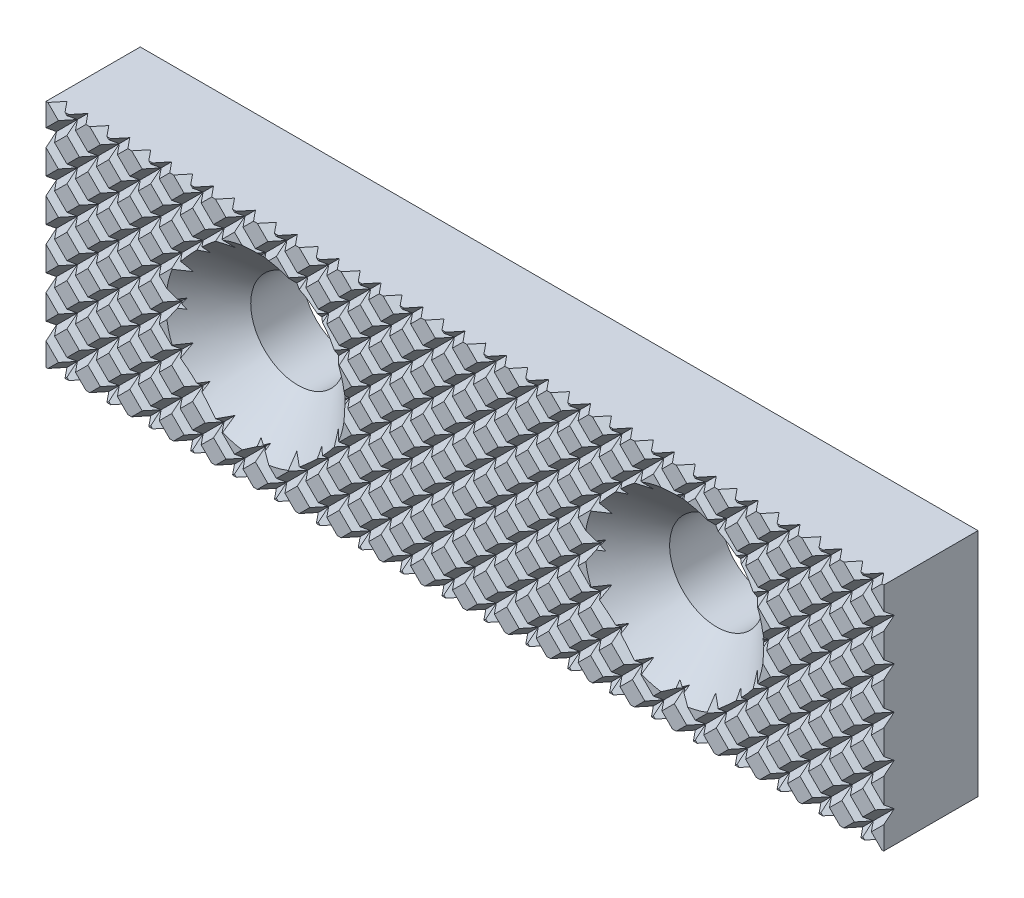
from build123d import *

# Parameters (mm, degrees)
SKETCH_1_W             = 80
SKETCH_1_H             = 22
EXTRUDE_3_DEPTH        = 9
SKETCH_6_R             = 4.5
CUT_EXTRUDE_2_DEPTH    = 43.449970554
CHAMFER_1_SIZE         = 4.05
CHAMFER_2_SIZE         = 4.05
CUT_EXTRUDE_3_DEPTH    = 69.132224388
PATTERN_LINEAR_4_COUNT = 13
PATTERN_LINEAR_4_PITCH = 4
PATTERN_LINEAR_5_COUNT = 15
PATTERN_LINEAR_5_PITCH = 4
MIRROR_1_COPY_1_DEPTH  = 69.132224388
MIRROR_1_COPY_2_DEPTH  = 69.132224388
MIRROR_1_COPY_3_DEPTH  = 69.132224388
MIRROR_1_COPY_4_DEPTH  = 69.132224388
MIRROR_1_COPY_5_DEPTH  = 69.132224388
MIRROR_1_COPY_6_DEPTH  = 69.132224388
MIRROR_1_COPY_7_DEPTH  = 69.132224388
MIRROR_1_COPY_8_DEPTH  = 69.132224388
MIRROR_1_COPY_9_DEPTH  = 69.132224388
MIRROR_1_COPY_10_DEPTH = 69.132224388
MIRROR_1_COPY_11_DEPTH = 69.132224388
MIRROR_1_COPY_12_DEPTH = 69.132224388
MIRROR_1_COPY_13_DEPTH = 69.132224388
MIRROR_1_COPY_14_DEPTH = 69.132224388
MIRROR_1_COPY_15_DEPTH = 69.132224388
MIRROR_1_COPY_16_DEPTH = 69.132224388
MIRROR_1_COPY_17_DEPTH = 69.132224388
MIRROR_1_COPY_18_DEPTH = 69.132224388
MIRROR_1_COPY_19_DEPTH = 69.132224388
MIRROR_1_COPY_20_DEPTH = 69.132224388
MIRROR_1_COPY_21_DEPTH = 69.132224388
MIRROR_1_COPY_22_DEPTH = 69.132224388
MIRROR_1_COPY_23_DEPTH = 69.132224388
MIRROR_1_COPY_24_DEPTH = 69.132224388
MIRROR_1_COPY_25_DEPTH = 69.132224388
MIRROR_1_COPY_26_DEPTH = 69.132224388
MIRROR_1_COPY_27_DEPTH = 69.132224388
MIRROR_1_COPY_28_DEPTH = 69.132224388


with BuildPart() as part:
    # 草图1 → 凸台-拉伸3 (new body)
    with BuildSketch(Plane.XY):
        Rectangle(SKETCH_1_W, SKETCH_1_H)
    extrude(amount=EXTRUDE_3_DEPTH)

    # 草图6 → 切除-拉伸2 (cut, through all)
    with BuildSketch(Plane.XY.offset(9)):
        with Locations((-20, 0)):
            Circle(SKETCH_6_R)
        with Locations((20, 0)):
            Circle(SKETCH_6_R)
    extrude(amount=-CUT_EXTRUDE_2_DEPTH, mode=Mode.SUBTRACT)

    # 倒角1
    chamfer_1_edges = [part.edges().sort_by_distance(p)[0] for p in [
        (-24.5, 0, 9),
    ]]
    chamfer(chamfer_1_edges, length=CHAMFER_1_SIZE)

    # 倒角2
    chamfer_2_edges = [part.edges().sort_by_distance(p)[0] for p in [
        (15.5, 0, 9),
    ]]
    chamfer(chamfer_2_edges, length=CHAMFER_2_SIZE)

    # 草图7 → 切除-拉伸3 (cut, through all)
    with BuildSketch(Plane(origin=(-20, -20, 0), x_dir=(0.7071067811865462, -0.7071067811865488, 0), z_dir=(-0.7071067811865488, -0.7071067811865462, 0))):
        Polygon((0, 8), (-0.577350269, 9), (0.577350269, 9), align=None)
    cut_extrude_3 = extrude(amount=-CUT_EXTRUDE_3_DEPTH, mode=Mode.SUBTRACT)

    # 阵列(线性)4: 切除-拉伸3 ×13
    with Locations(*[(-i * PATTERN_LINEAR_4_PITCH, 0, 0) for i in range(1, PATTERN_LINEAR_4_COUNT)]):
        add(cut_extrude_3, mode=Mode.SUBTRACT)

    # 阵列(线性)5: 切除-拉伸3 ×15
    with Locations(*[(i * PATTERN_LINEAR_5_PITCH, 0, 0) for i in range(1, PATTERN_LINEAR_5_COUNT)]):
        add(cut_extrude_3, mode=Mode.SUBTRACT)

    # 镜向1 copy 1 sketch → 镜向1 copy 1 (cut, through all)
    with BuildSketch(Plane(origin=(24, -20, 0), x_dir=(-0.7071067811865462, -0.7071067811865488, 0), z_dir=(0.7071067811865488, -0.7071067811865462, 0))):
        Polygon((0, -8), (-0.577350269, -9), (0.577350269, -9), align=None)
    extrude(amount=-MIRROR_1_COPY_1_DEPTH, mode=Mode.SUBTRACT)

    # 镜向1 copy 2 sketch → 镜向1 copy 2 (cut, through all)
    with BuildSketch(Plane(origin=(28, -20, 0), x_dir=(-0.7071067811865462, -0.7071067811865488, 0), z_dir=(0.7071067811865488, -0.7071067811865462, 0))):
        Polygon((0, -8), (-0.577350269, -9), (0.577350269, -9), align=None)
    extrude(amount=-MIRROR_1_COPY_2_DEPTH, mode=Mode.SUBTRACT)

    # 镜向1 copy 3 sketch → 镜向1 copy 3 (cut, through all)
    with BuildSketch(Plane(origin=(32, -20, 0), x_dir=(-0.7071067811865462, -0.7071067811865488, 0), z_dir=(0.7071067811865488, -0.7071067811865462, 0))):
        Polygon((0, -8), (-0.577350269, -9), (0.577350269, -9), align=None)
    extrude(amount=-MIRROR_1_COPY_3_DEPTH, mode=Mode.SUBTRACT)

    # 镜向1 copy 4 sketch → 镜向1 copy 4 (cut, through all)
    with BuildSketch(Plane(origin=(36, -20, 0), x_dir=(-0.7071067811865462, -0.7071067811865488, 0), z_dir=(0.7071067811865488, -0.7071067811865462, 0))):
        Polygon((0, -8), (-0.577350269, -9), (0.577350269, -9), align=None)
    extrude(amount=-MIRROR_1_COPY_4_DEPTH, mode=Mode.SUBTRACT)

    # 镜向1 copy 5 sketch → 镜向1 copy 5 (cut, through all)
    with BuildSketch(Plane(origin=(40, -20, 0), x_dir=(-0.7071067811865462, -0.7071067811865488, 0), z_dir=(0.7071067811865488, -0.7071067811865462, 0))):
        Polygon((0, -8), (-0.577350269, -9), (0.577350269, -9), align=None)
    extrude(amount=-MIRROR_1_COPY_5_DEPTH, mode=Mode.SUBTRACT)

    # 镜向1 copy 6 sketch → 镜向1 copy 6 (cut, through all)
    with BuildSketch(Plane(origin=(44, -20, 0), x_dir=(-0.7071067811865462, -0.7071067811865488, 0), z_dir=(0.7071067811865488, -0.7071067811865462, 0))):
        Polygon((0, -8), (-0.577350269, -9), (0.577350269, -9), align=None)
    extrude(amount=-MIRROR_1_COPY_6_DEPTH, mode=Mode.SUBTRACT)

    # 镜向1 copy 7 sketch → 镜向1 copy 7 (cut, through all)
    with BuildSketch(Plane(origin=(48, -20, 0), x_dir=(-0.7071067811865462, -0.7071067811865488, 0), z_dir=(0.7071067811865488, -0.7071067811865462, 0))):
        Polygon((0, -8), (-0.577350269, -9), (0.577350269, -9), align=None)
    extrude(amount=-MIRROR_1_COPY_7_DEPTH, mode=Mode.SUBTRACT)

    # 镜向1 copy 8 sketch → 镜向1 copy 8 (cut, through all)
    with BuildSketch(Plane(origin=(52, -20, 0), x_dir=(-0.7071067811865462, -0.7071067811865488, 0), z_dir=(0.7071067811865488, -0.7071067811865462, 0))):
        Polygon((0, -8), (-0.577350269, -9), (0.577350269, -9), align=None)
    extrude(amount=-MIRROR_1_COPY_8_DEPTH, mode=Mode.SUBTRACT)

    # 镜向1 copy 9 sketch → 镜向1 copy 9 (cut, through all)
    with BuildSketch(Plane(origin=(56, -20, 0), x_dir=(-0.7071067811865462, -0.7071067811865488, 0), z_dir=(0.7071067811865488, -0.7071067811865462, 0))):
        Polygon((0, -8), (-0.577350269, -9), (0.577350269, -9), align=None)
    extrude(amount=-MIRROR_1_COPY_9_DEPTH, mode=Mode.SUBTRACT)

    # 镜向1 copy 10 sketch → 镜向1 copy 10 (cut, through all)
    with BuildSketch(Plane(origin=(60, -20, 0), x_dir=(-0.7071067811865462, -0.7071067811865488, 0), z_dir=(0.7071067811865488, -0.7071067811865462, 0))):
        Polygon((0, -8), (-0.577350269, -9), (0.577350269, -9), align=None)
    extrude(amount=-MIRROR_1_COPY_10_DEPTH, mode=Mode.SUBTRACT)

    # 镜向1 copy 11 sketch → 镜向1 copy 11 (cut, through all)
    with BuildSketch(Plane(origin=(64, -20, 0), x_dir=(-0.7071067811865462, -0.7071067811865488, 0), z_dir=(0.7071067811865488, -0.7071067811865462, 0))):
        Polygon((0, -8), (-0.577350269, -9), (0.577350269, -9), align=None)
    extrude(amount=-MIRROR_1_COPY_11_DEPTH, mode=Mode.SUBTRACT)

    # 镜向1 copy 12 sketch → 镜向1 copy 12 (cut, through all)
    with BuildSketch(Plane(origin=(68, -20, 0), x_dir=(-0.7071067811865462, -0.7071067811865488, 0), z_dir=(0.7071067811865488, -0.7071067811865462, 0))):
        Polygon((0, -8), (-0.577350269, -9), (0.577350269, -9), align=None)
    extrude(amount=-MIRROR_1_COPY_12_DEPTH, mode=Mode.SUBTRACT)

    # 镜向1 copy 13 sketch → 镜向1 copy 13 (cut, through all)
    with BuildSketch(Plane(origin=(20, -20, 0), x_dir=(-0.7071067811865462, -0.7071067811865488, 0), z_dir=(0.7071067811865488, -0.7071067811865462, 0))):
        Polygon((0, -8), (-0.577350269, -9), (0.577350269, -9), align=None)
    extrude(amount=-MIRROR_1_COPY_13_DEPTH, mode=Mode.SUBTRACT)

    # 镜向1 copy 14 sketch → 镜向1 copy 14 (cut, through all)
    with BuildSketch(Plane(origin=(16, -20, 0), x_dir=(-0.7071067811865462, -0.7071067811865488, 0), z_dir=(0.7071067811865488, -0.7071067811865462, 0))):
        Polygon((0, -8), (-0.577350269, -9), (0.577350269, -9), align=None)
    extrude(amount=-MIRROR_1_COPY_14_DEPTH, mode=Mode.SUBTRACT)

    # 镜向1 copy 15 sketch → 镜向1 copy 15 (cut, through all)
    with BuildSketch(Plane(origin=(12, -20, 0), x_dir=(-0.7071067811865462, -0.7071067811865488, 0), z_dir=(0.7071067811865488, -0.7071067811865462, 0))):
        Polygon((0, -8), (-0.577350269, -9), (0.577350269, -9), align=None)
    extrude(amount=-MIRROR_1_COPY_15_DEPTH, mode=Mode.SUBTRACT)

    # 镜向1 copy 16 sketch → 镜向1 copy 16 (cut, through all)
    with BuildSketch(Plane(origin=(8, -20, 0), x_dir=(-0.7071067811865462, -0.7071067811865488, 0), z_dir=(0.7071067811865488, -0.7071067811865462, 0))):
        Polygon((0, -8), (-0.577350269, -9), (0.577350269, -9), align=None)
    extrude(amount=-MIRROR_1_COPY_16_DEPTH, mode=Mode.SUBTRACT)

    # 镜向1 copy 17 sketch → 镜向1 copy 17 (cut, through all)
    with BuildSketch(Plane(origin=(4, -20, 0), x_dir=(-0.7071067811865462, -0.7071067811865488, 0), z_dir=(0.7071067811865488, -0.7071067811865462, 0))):
        Polygon((0, -8), (-0.577350269, -9), (0.577350269, -9), align=None)
    extrude(amount=-MIRROR_1_COPY_17_DEPTH, mode=Mode.SUBTRACT)

    # 镜向1 copy 18 sketch → 镜向1 copy 18 (cut, through all)
    with BuildSketch(Plane(origin=(0, -20, 0), x_dir=(-0.7071067811865462, -0.7071067811865488, 0), z_dir=(0.7071067811865488, -0.7071067811865462, 0))):
        Polygon((0, -8), (-0.577350269, -9), (0.577350269, -9), align=None)
    extrude(amount=-MIRROR_1_COPY_18_DEPTH, mode=Mode.SUBTRACT)

    # 镜向1 copy 19 sketch → 镜向1 copy 19 (cut, through all)
    with BuildSketch(Plane(origin=(-4, -20, 0), x_dir=(-0.7071067811865462, -0.7071067811865488, 0), z_dir=(0.7071067811865488, -0.7071067811865462, 0))):
        Polygon((0, -8), (-0.577350269, -9), (0.577350269, -9), align=None)
    extrude(amount=-MIRROR_1_COPY_19_DEPTH, mode=Mode.SUBTRACT)

    # 镜向1 copy 20 sketch → 镜向1 copy 20 (cut, through all)
    with BuildSketch(Plane(origin=(-8, -20, 0), x_dir=(-0.7071067811865462, -0.7071067811865488, 0), z_dir=(0.7071067811865488, -0.7071067811865462, 0))):
        Polygon((0, -8), (-0.577350269, -9), (0.577350269, -9), align=None)
    extrude(amount=-MIRROR_1_COPY_20_DEPTH, mode=Mode.SUBTRACT)

    # 镜向1 copy 21 sketch → 镜向1 copy 21 (cut, through all)
    with BuildSketch(Plane(origin=(-12, -20, 0), x_dir=(-0.7071067811865462, -0.7071067811865488, 0), z_dir=(0.7071067811865488, -0.7071067811865462, 0))):
        Polygon((0, -8), (-0.577350269, -9), (0.577350269, -9), align=None)
    extrude(amount=-MIRROR_1_COPY_21_DEPTH, mode=Mode.SUBTRACT)

    # 镜向1 copy 22 sketch → 镜向1 copy 22 (cut, through all)
    with BuildSketch(Plane(origin=(-16, -20, 0), x_dir=(-0.7071067811865462, -0.7071067811865488, 0), z_dir=(0.7071067811865488, -0.7071067811865462, 0))):
        Polygon((0, -8), (-0.577350269, -9), (0.577350269, -9), align=None)
    extrude(amount=-MIRROR_1_COPY_22_DEPTH, mode=Mode.SUBTRACT)

    # 镜向1 copy 23 sketch → 镜向1 copy 23 (cut, through all)
    with BuildSketch(Plane(origin=(-20, -20, 0), x_dir=(-0.7071067811865462, -0.7071067811865488, 0), z_dir=(0.7071067811865488, -0.7071067811865462, 0))):
        Polygon((0, -8), (-0.577350269, -9), (0.577350269, -9), align=None)
    extrude(amount=-MIRROR_1_COPY_23_DEPTH, mode=Mode.SUBTRACT)

    # 镜向1 copy 24 sketch → 镜向1 copy 24 (cut, through all)
    with BuildSketch(Plane(origin=(-24, -20, 0), x_dir=(-0.7071067811865462, -0.7071067811865488, 0), z_dir=(0.7071067811865488, -0.7071067811865462, 0))):
        Polygon((0, -8), (-0.577350269, -9), (0.577350269, -9), align=None)
    extrude(amount=-MIRROR_1_COPY_24_DEPTH, mode=Mode.SUBTRACT)

    # 镜向1 copy 25 sketch → 镜向1 copy 25 (cut, through all)
    with BuildSketch(Plane(origin=(-28, -20, 0), x_dir=(-0.7071067811865462, -0.7071067811865488, 0), z_dir=(0.7071067811865488, -0.7071067811865462, 0))):
        Polygon((0, -8), (-0.577350269, -9), (0.577350269, -9), align=None)
    extrude(amount=-MIRROR_1_COPY_25_DEPTH, mode=Mode.SUBTRACT)

    # 镜向1 copy 26 sketch → 镜向1 copy 26 (cut, through all)
    with BuildSketch(Plane(origin=(-32, -20, 0), x_dir=(-0.7071067811865462, -0.7071067811865488, 0), z_dir=(0.7071067811865488, -0.7071067811865462, 0))):
        Polygon((0, -8), (-0.577350269, -9), (0.577350269, -9), align=None)
    extrude(amount=-MIRROR_1_COPY_26_DEPTH, mode=Mode.SUBTRACT)

    # 镜向1 copy 27 sketch → 镜向1 copy 27 (cut, through all)
    with BuildSketch(Plane(origin=(-36, -20, 0), x_dir=(-0.7071067811865462, -0.7071067811865488, 0), z_dir=(0.7071067811865488, -0.7071067811865462, 0))):
        Polygon((0, -8), (-0.577350269, -9), (0.577350269, -9), align=None)
    extrude(amount=-MIRROR_1_COPY_27_DEPTH, mode=Mode.SUBTRACT)

    # 镜向1 copy 28 sketch → 镜向1 copy 28 (cut, through all)
    with BuildSketch(Plane(origin=(20, -20, 0), x_dir=(-0.7071067811865462, -0.7071067811865488, 0), z_dir=(0.7071067811865488, -0.7071067811865462, 0))):
        Polygon((0, -8), (-0.577350269, -9), (0.577350269, -9), align=None)
    extrude(amount=-MIRROR_1_COPY_28_DEPTH, mode=Mode.SUBTRACT)


solid = part.part
